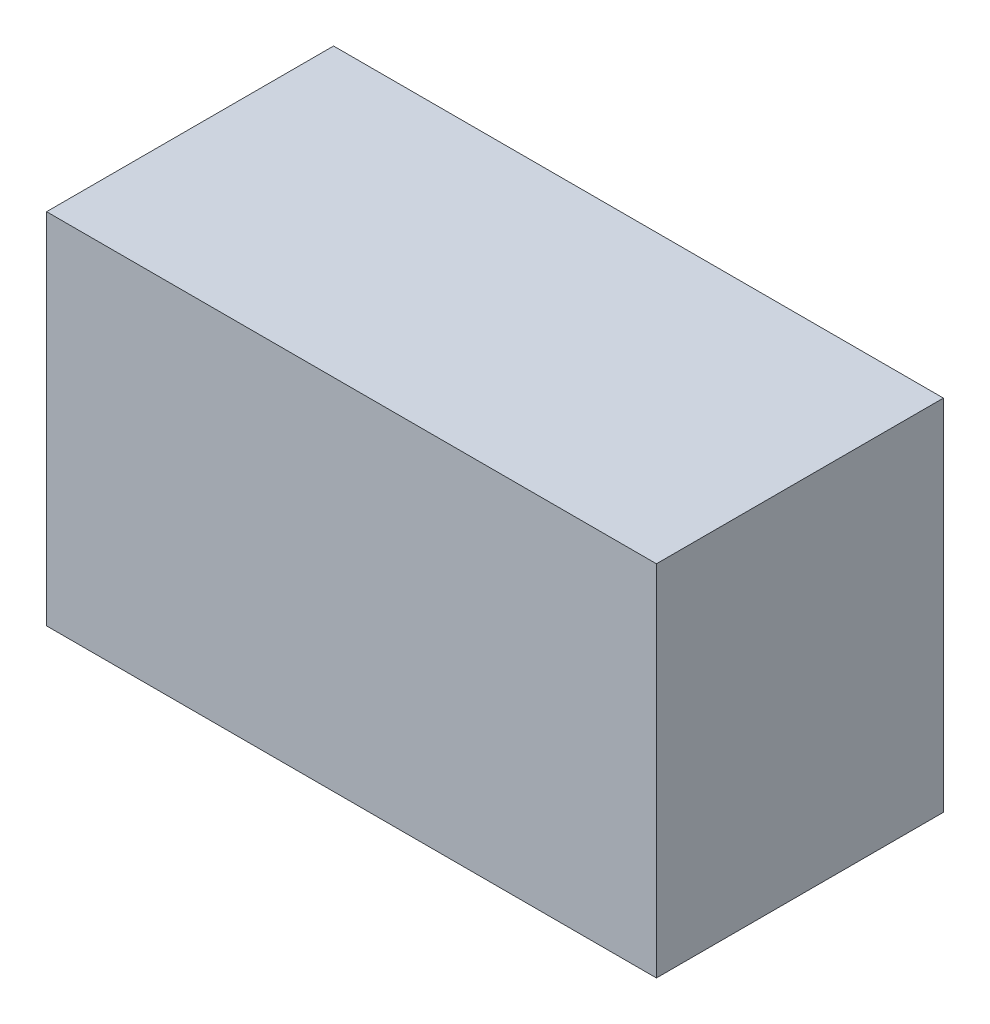
from build123d import *

# Parameters (mm, degrees)
SKETCH1_W           = 215.9
SKETCH1_H           = 127
BOSS_EXTRUDE1_DEPTH = 101.6


with BuildPart() as part:
    # Sketch1 → Boss-Extrude1 (new body)
    with BuildSketch(Plane.XY):
        Rectangle(SKETCH1_W, SKETCH1_H)
    extrude(amount=BOSS_EXTRUDE1_DEPTH)


solid = part.part
